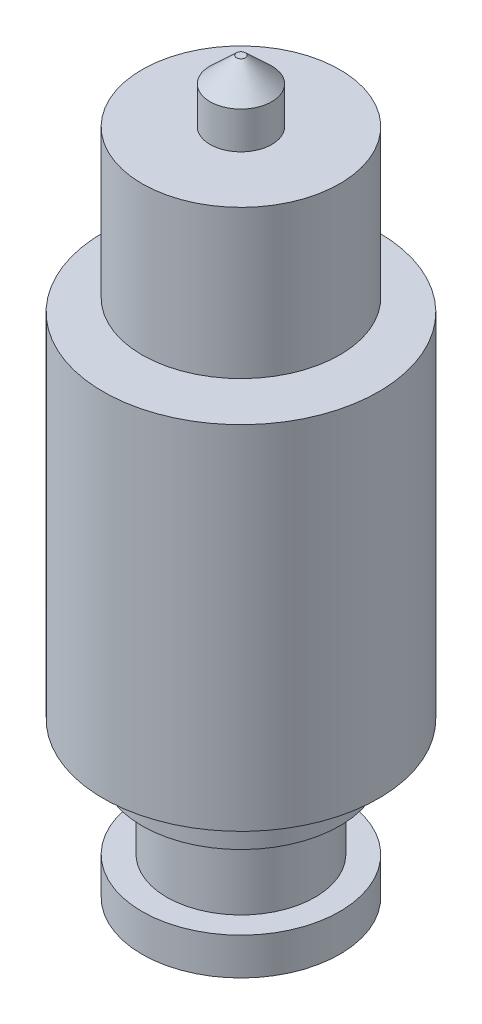
from build123d import *

# Parameters (mm, degrees)
SKETCH1_R           = 8
BOSS_EXTRUDE1_DEPTH = 3
SKETCH2_R           = 6
BOSS_EXTRUDE2_DEPTH = 6
SKETCH3_R           = 8
BOSS_EXTRUDE3_DEPTH = 1.5
SKETCH4_R           = 5
BOSS_EXTRUDE4_DEPTH = 2
SKETCH5_R           = 11.15
BOSS_EXTRUDE5_DEPTH = 28.5
SKETCH6_R           = 2
BOSS_EXTRUDE6_DEPTH = 1
SKETCH7_R           = 8
BOSS_EXTRUDE7_DEPTH = 12
SKETCH8_R           = 2.5
BOSS_EXTRUDE8_DEPTH = 3
SKETCH9_R           = 2.5
BOSS_EXTRUDE9_DEPTH = 2
BOSS_EXTRUDE9_TAPER = 47
SKETCH_1_R          = 2.5
CUT_EXTRUDE_1_DEPTH = 10


with BuildPart() as part:
    # Sketch1 → Boss-Extrude1 (new body)
    with BuildSketch(Plane(origin=(0, 0, 0), x_dir=(1, 0, 0), z_dir=(0, 1, 0))):
        Circle(SKETCH1_R)
    extrude(amount=BOSS_EXTRUDE1_DEPTH)

    # Sketch2 → Boss-Extrude2 (add)
    with BuildSketch(Plane(origin=(0, 3, 0), x_dir=(1, 0, 0), z_dir=(0, 1, 0))):
        Circle(SKETCH2_R)
    extrude(amount=BOSS_EXTRUDE2_DEPTH)

    # Sketch3 → Boss-Extrude3 (add)
    with BuildSketch(Plane(origin=(0, 9, 0), x_dir=(1, 0, 0), z_dir=(0, 1, 0))):
        Circle(SKETCH3_R)
    extrude(amount=BOSS_EXTRUDE3_DEPTH)

    # Sketch4 → Boss-Extrude4 (add)
    with BuildSketch(Plane(origin=(0, 10.5, 0), x_dir=(1, 0, 0), z_dir=(0, 1, 0))):
        Circle(SKETCH4_R)
    extrude(amount=BOSS_EXTRUDE4_DEPTH)

    # Sketch5 → Boss-Extrude5 (add)
    with BuildSketch(Plane(origin=(0, 12.5, 0), x_dir=(1, 0, 0), z_dir=(0, 1, 0))):
        Circle(SKETCH5_R)
    extrude(amount=BOSS_EXTRUDE5_DEPTH)

    # Sketch6 → Boss-Extrude6 (add)
    with BuildSketch(Plane(origin=(0, 41, 0), x_dir=(1, 0, 0), z_dir=(0, 1, 0))):
        Circle(SKETCH6_R)
    extrude(amount=BOSS_EXTRUDE6_DEPTH)

    # Sketch7 → Boss-Extrude7 (add)
    with BuildSketch(Plane(origin=(0, 42, 0), x_dir=(1, 0, 0), z_dir=(0, 1, 0))):
        Circle(SKETCH7_R)
    extrude(amount=BOSS_EXTRUDE7_DEPTH)

    # Sketch8 → Boss-Extrude8 (add)
    with BuildSketch(Plane(origin=(0, 54, 0), x_dir=(1, 0, 0), z_dir=(0, 1, 0))):
        Circle(SKETCH8_R)
    extrude(amount=BOSS_EXTRUDE8_DEPTH)

    # Sketch9 → Boss-Extrude9 (add)
    with BuildSketch(Plane(origin=(0, 57, 0), x_dir=(1, 0, 0), z_dir=(0, 1, 0))):
        Circle(SKETCH9_R)
    extrude(amount=BOSS_EXTRUDE9_DEPTH, taper=BOSS_EXTRUDE9_TAPER)

    # 草图1 → 切除-拉伸1 (cut)
    with BuildSketch(Plane(origin=(0, 0, 0), x_dir=(-1, 0, 0), z_dir=(0, -1, 0))):
        Circle(SKETCH_1_R)
    extrude(amount=-CUT_EXTRUDE_1_DEPTH, mode=Mode.SUBTRACT)


solid = part.part
